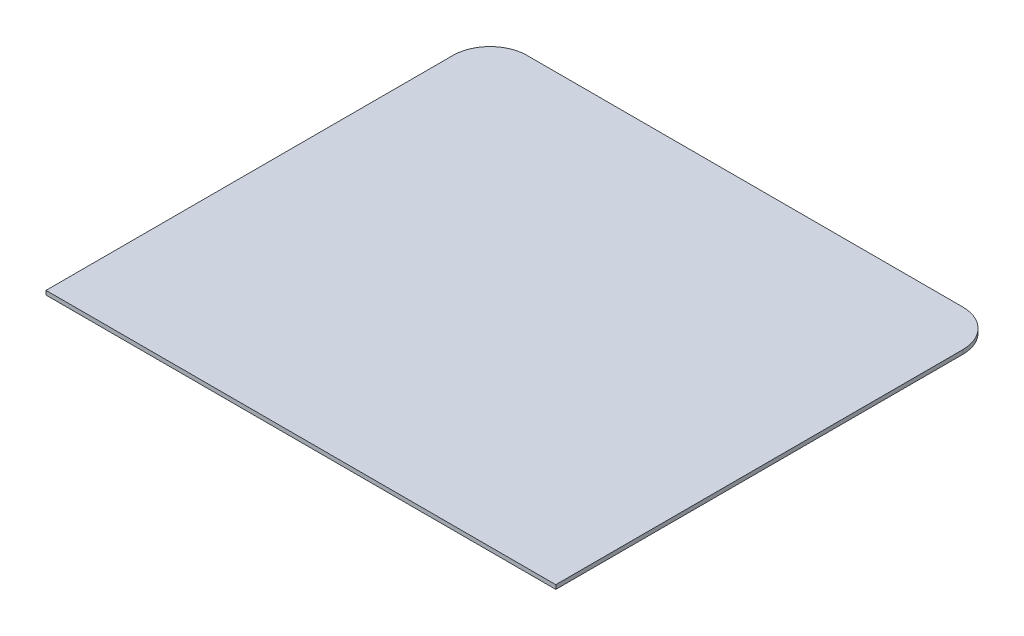
from build123d import *

# Parameters (mm, degrees)
SKETCH1_W           = 393.7
SKETCH1_H           = 342.9
BOSS_EXTRUDE1_DEPTH = 3.175
FILLET1_R           = 28.575


with BuildPart() as part:
    # Sketch1 → Boss-Extrude1 (new body)
    with BuildSketch(Plane(origin=(0, 0, 0), x_dir=(1, 0, 0), z_dir=(0, 1, 0))):
        Rectangle(SKETCH1_W, SKETCH1_H)
    extrude(amount=BOSS_EXTRUDE1_DEPTH)

    # Fillet1
    fillet1_edges = [part.edges().sort_by_distance(p)[0] for p in [
        (-196.85, 1.5875, -171.45),
        (196.85, 1.5875, -171.45),
    ]]
    fillet(fillet1_edges, radius=FILLET1_R)


solid = part.part
